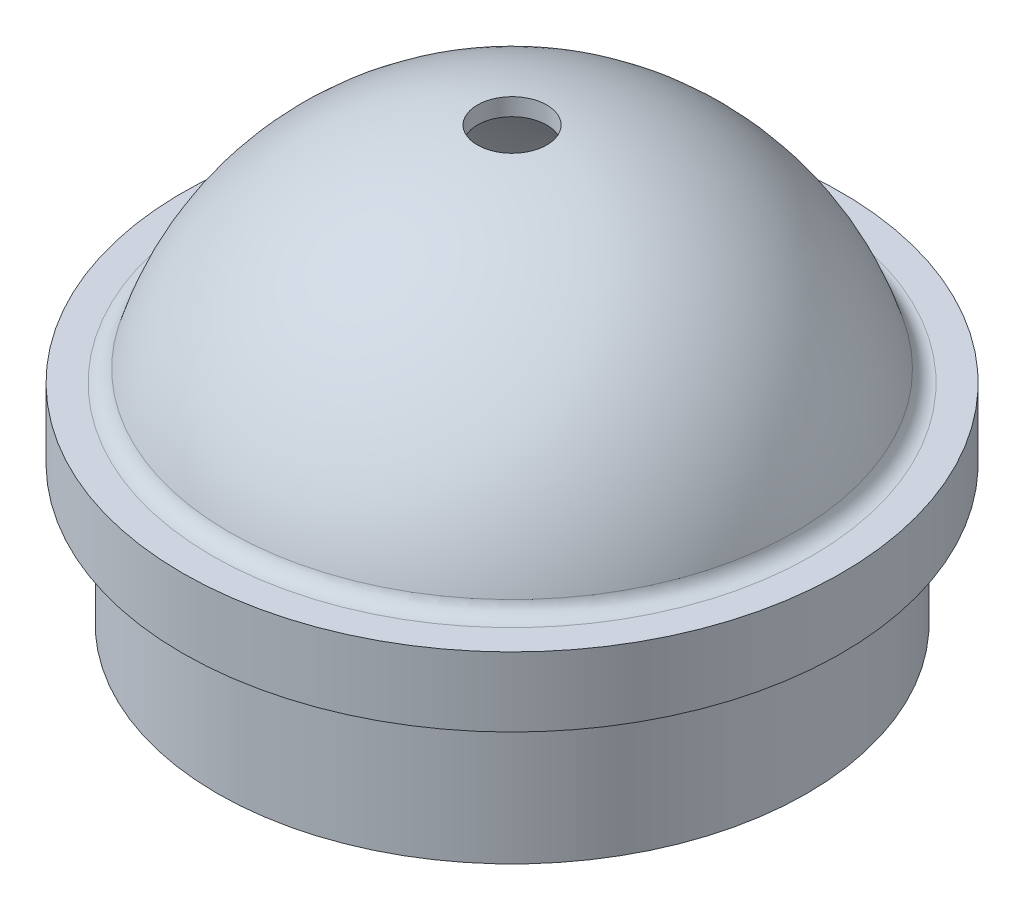
from build123d import *


with BuildPart() as part:
    # Sketch1 → Revolve7 (revolve)
    with BuildSketch(Plane.XY):
        with BuildLine():
            Line((-53.975, 0), (-53.975, 25.4))
            Line((-53.975, 25.4), (-60.325, 25.4))
            Line((-60.325, 25.4), (-60.325, 38.1))
            Line((-60.325, 38.1), (-54.876478898, 38.1))
            ThreePointArc((-54.876478898, 38.1), (-52.968691921, 38.737092624), (-51.826534557, 40.392693639))
            ThreePointArc((-51.826534557, 40.392693639), (-34.904240815, 66.539573647), (-6.35, 78.976562476))
            Line((-6.35, 78.976562476), (-6.35, 75.801562476))
            ThreePointArc((-6.35, 75.801562476), (-38.1, 59.001041651), (-50.8, 25.4))
            Line((-50.8, 25.4), (-50.8, 0))
            Line((-50.8, 0), (-53.975, 0))
        make_face()
    revolve(axis=Axis((0, 121.236821391, 0), (0, -1, 0)))


solid = part.part
